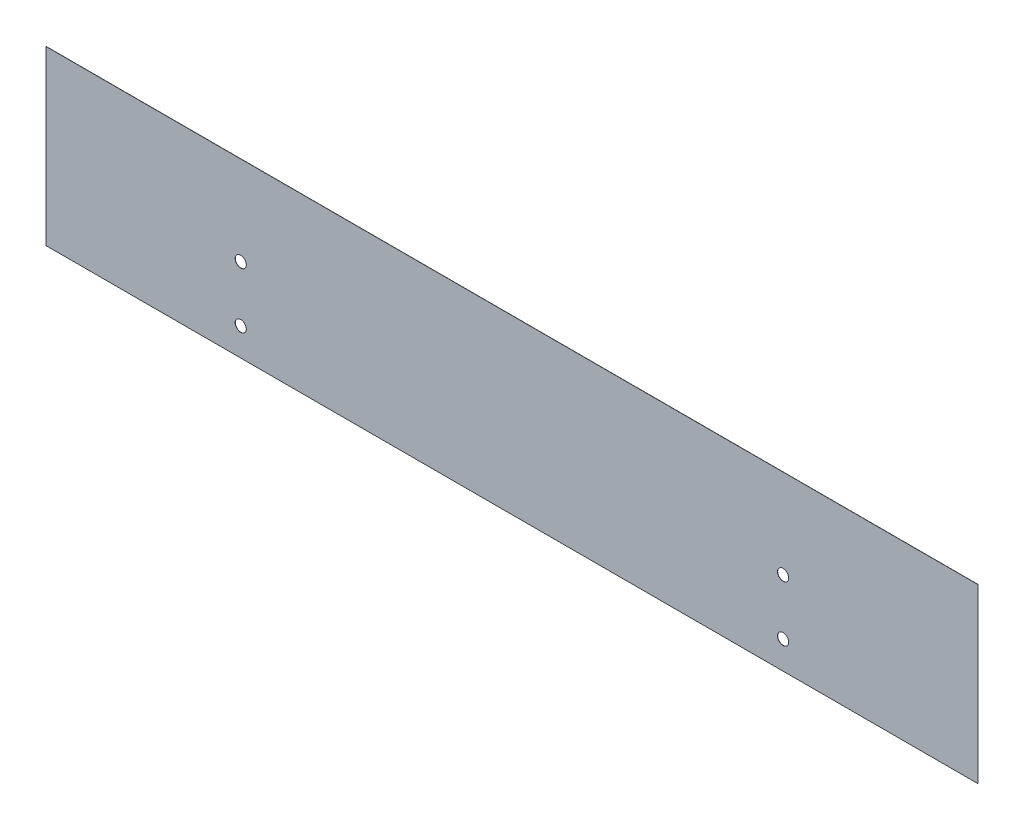
from build123d import *

# Parameters (mm, degrees)
SKETCH1_W            = 335
SKETCH1_H            = 62
BODY_DEPTH           = 0.0625
SKETCH3_R            = 2
MOUNTING_HOLES_DEPTH = 0.0625


with BuildPart() as part:
    # Sketch1 → Body (new body)
    with BuildSketch(Plane.XY):
        Rectangle(SKETCH1_W, SKETCH1_H)
    extrude(amount=BODY_DEPTH)

    # Sketch3 → Mounting Holes (cut)
    with BuildSketch(Plane.XY.offset(0.0625)):
        with Locations((-97.5, -1)):
            Circle(SKETCH3_R)
        with Locations((-97.5, -21)):
            Circle(SKETCH3_R)
        with Locations((97.5, -1)):
            Circle(SKETCH3_R)
        with Locations((97.5, -21)):
            Circle(SKETCH3_R)
    extrude(amount=-MOUNTING_HOLES_DEPTH, mode=Mode.SUBTRACT)


solid = part.part
